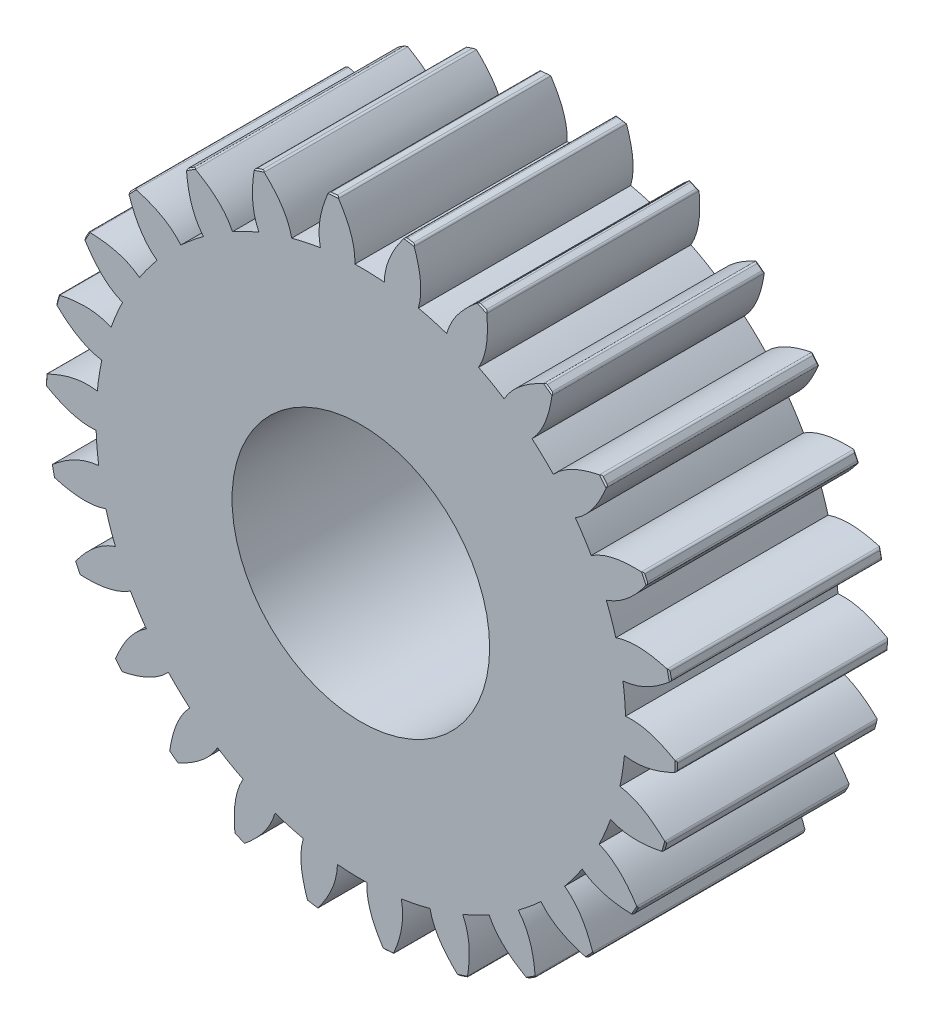
from build123d import *

# Parameters (mm, degrees)
BOSS_EXTRUDE1_DEPTH = 32.97
CHAMFER1_SIZE       = 0.2
FILLET1_R           = 0.4
CIRPATTERN1_DEPTH   = 32.97
SKETCH2_R           = 20
CUT_EXTRUDE1_DEPTH  = 77.636694373


with BuildPart() as part:
    # Sketch1 → Boss-Extrude1 (new body)
    with BuildSketch(Plane.XY):
        with BuildLine():
            add(Edge.make_bspline(
                [(-0.925368628, 41.114587653), (-0.902720236, 41.709621639), (-0.93904966, 42.292282206), (-1.024441582, 42.862759412)],
                knots=[-0.076387463, -0.076387463, -0.076387463, -0.076387463, 0, 0, 0, 0], degree=3))
            ThreePointArc((-1.024441582, 42.862759412), (-3.763344449, 42.709517248), (-6.486841795, 42.381440614))
            add(Edge.make_bspline(
                [(-6.278681799, 40.642881048), (-6.40503601, 41.224785686), (-6.471157416, 41.804821133), (-6.486841795, 42.381440614)],
                knots=[-0.076387463, -0.076387463, -0.076387463, -0.076387463, 0, 0, 0, 0], degree=3))
            ThreePointArc((-6.278681799, 40.642881048), (-3.609738553, 40.966271646), (-0.925368628, 41.114587653))
        make_face()
        with BuildLine():
            ThreePointArc((-6.486841795, 42.381440614), (-3.763344449, 42.709517248), (-1.024441582, 42.862759412))
            add(Edge.make_bspline(
                [(-1.024441582, 42.862759412), (-1.094438327, 43.330386175), (-1.505724376, 45.165619613), (-2.495832818, 47.152783337), (-3.42184293, 48.609180491), (-3.593178775, 48.868078193)],
                knots=[0, 0, 0, 0, 0.062615686, 0.250118172, 0.291291531, 0.291291531, 0.291291531, 0.291291531], degree=3))
            ThreePointArc((-3.593178775, 48.868078193), (-4.300965145, 48.81087685), (-5.007848271, 48.743424743))
            add(Edge.make_bspline(
                [(-6.486841795, 42.381440614), (-6.499698463, 42.85410227), (-6.415680867, 44.732979352), (-5.788328092, 46.862665284), (-5.131270019, 48.458554506), (-5.007848271, 48.743424743)],
                knots=[0, 0, 0, 0, 0.062615686, 0.250118172, 0.291291526, 0.291291526, 0.291291526, 0.291291526], degree=3))
        make_face()
        with BuildLine():
            ThreePointArc((41.125, 0), (28.750737731, 29.405113584), (-0.925368628, 41.114587653))
            ThreePointArc((-0.925368628, 41.114587653), (-3.609738553, 40.966271646), (-6.278681799, 40.642881048))
            ThreePointArc((-6.278681799, 40.642881048), (-26.768029774, -31.220797668), (41.125, 0))
        make_face()
    extrude(amount=BOSS_EXTRUDE1_DEPTH)

    # Chamfer1
    chamfer1_edges = [part.edges().sort_by_distance(p)[0] for p in [
        (-4.300965145, 48.81087685, 32.97),
        (-4.300965145, 48.81087685, 0),
    ]]
    chamfer(chamfer1_edges, length=CHAMFER1_SIZE)

    # Fillet1
    # the kernel refuses this fillet: 0.4 mm, written as the material it takes off along each edge
    with BuildSketch(Plane(origin=(-5.007848271, 48.743424743, -0.39511391), x_dir=(-0.3932429274357133, -0.9194346088884137, 0), z_dir=(0, 0, 1))) as fillet1_piece_1:
        with BuildLine():
            CenterArc((0.236166139, 0.399995585), FILLET1_R, 208.745087024, 61.524121721)
            ThreePointArc((-0.114541059, 0.207630149), (-0.057396129, 0.103745786), (0, 0))
            ThreePointArc((0, 0), (0.119022781, -0.000279267), (0.238045564, 0))
        make_face()
    extrude(amount=33.760227819, mode=Mode.SUBTRACT)
    with BuildSketch(Plane(origin=(-3.593178775, 48.868078193, -0.395113824), x_dir=(0.5479670220639341, -0.8364999358818769, 0), z_dir=(0, 0, 1))) as fillet1_piece_2:
        with BuildLine():
            CenterArc((0.236166105, -0.399995585), FILLET1_R, 89.73079124, 61.52411446)
            ThreePointArc((-0.114541069, -0.207630104), (-0.057396134, -0.103745764), (0, 0))
            ThreePointArc((0, 0), (0.119022764, 0.000279267), (0.23804553, 0))
        make_face()
    extrude(amount=33.760227649, mode=Mode.SUBTRACT)

    # CirPattern1: read off the stored shape, not the designer's step
    # CirPattern1 outline → CirPattern1 (add)
    with BuildSketch(Plane.XY):
        with BuildLine():
            add(Edge.make_bspline(
                [(-15.822712794, 37.959285884), (-16.084654275, 38.494042889), (-16.454076844, 39.490074357), (-16.93455551, 41.897747342), (-16.838691947, 44.035573473), (-16.602239944, 45.66531667), (-16.565905599, 45.893663153)],
                knots=[-0.076387463, -0.076387463, -0.076387463, -0.076387463, 0, 0.062615686, 0.250118172, 0.280770276, 0.280770276, 0.280770276, 0.280770276], degree=3))
            ThreePointArc((-15.822712794, 37.959285884), (-13.308716624, 38.911999266), (-10.737843954, 39.698417252))
            add(Edge.make_bspline(
                [(-10.737843954, 39.698417252), (-10.858254636, 40.281580746), (-11.176182918, 41.295224339), (-12.270811023, 43.492845362), (-13.655808387, 45.124186342), (-14.840795417, 46.26776753), (-15.009359658, 46.42603443)],
                knots=[-0.076387463, -0.076387463, -0.076387463, -0.076387463, 0, 0.062615686, 0.250118172, 0.280770282, 0.280770282, 0.280770282, 0.280770282], degree=3))
            ThreePointArc((-15.009359658, 46.42603443), (-15.197033625, 46.525043861), (-15.408942381, 46.514132204))
            ThreePointArc((-15.408942381, 46.514132204), (-15.857194317, 46.363233153), (-16.303968843, 46.208014456))
            ThreePointArc((-16.303968843, 46.208014456), (-16.478174627, 46.086866859), (-16.565905599, 45.893663153))
        make_face()
        with BuildLine():
            ThreePointArc((3.630243359, 40.964459695), (6.299024401, 40.639733224), (8.940885759, 40.141327666))
            add(Edge.make_bspline(
                [(8.940885759, 40.141327666), (9.105276983, 40.713650931), (9.294829136, 41.758936398), (9.346869498, 44.213532221), (8.878637192, 46.30165329), (8.360831962, 47.864935075), (8.285126035, 48.083409164)],
                knots=[-0.076387463, -0.076387463, -0.076387463, -0.076387463, 0, 0.062615686, 0.250118172, 0.280770282, 0.280770282, 0.280770282, 0.280770282], degree=3))
            ThreePointArc((8.285126035, 48.083409164), (8.164960967, 48.258294102), (7.972254183, 48.347111219))
            ThreePointArc((7.972254183, 48.347111219), (7.50522052, 48.421809807), (7.037487598, 48.491996951))
            ThreePointArc((7.037487598, 48.491996951), (6.826935941, 48.465683546), (6.659467784, 48.335380776))
            add(Edge.make_bspline(
                [(3.630243359, 40.964459695), (3.646819668, 41.559693784), (3.782591131, 42.613315076), (4.476049829, 44.968493199), (5.554430139, 46.81689421), (6.521177418, 48.150075418), (6.659467784, 48.335380776)],
                knots=[-0.076387463, -0.076387463, -0.076387463, -0.076387463, 0, 0.062615686, 0.250118172, 0.280770276, 0.280770276, 0.280770276, 0.280770276], degree=3))
        make_face()
        with BuildLine():
            ThreePointArc((13.328191969, 38.905332844), (15.841710953, 37.951361226), (18.287528363, 36.835199622))
            add(Edge.make_bspline(
                [(18.287528363, 36.835199622), (18.584108601, 37.35155082), (19.018305898, 38.321099391), (19.656257292, 40.691915047), (19.701351046, 42.831414437), (19.572710114, 44.473188998), (19.551488336, 44.703432241)],
                knots=[-0.076387463, -0.076387463, -0.076387463, -0.076387463, 0, 0.062615686, 0.250118172, 0.280770282, 0.280770282, 0.280770282, 0.280770282], degree=3))
            ThreePointArc((19.551488336, 44.703432241), (19.476667751, 44.901992723), (19.310816003, 45.034346729))
            ThreePointArc((19.310816003, 45.034346729), (18.875230031, 45.218643182), (18.437885461, 45.398726631))
            ThreePointArc((18.437885461, 45.398726631), (18.227154843, 45.423566156), (18.033369513, 45.3371275))
            add(Edge.make_bspline(
                [(13.328191969, 38.905332844), (13.486735441, 39.479303543), (13.870709712, 40.469816278), (15.107648777, 42.590601675), (16.597044631, 44.127218212), (17.854751138, 45.19030183), (18.033369513, 45.3371275)],
                knots=[-0.076387463, -0.076387463, -0.076387463, -0.076387463, 0, 0.062615686, 0.250118172, 0.280770276, 0.280770276, 0.280770276, 0.280770276], degree=3))
        make_face()
        with BuildLine():
            ThreePointArc((22.251554507, 34.585169464), (24.463734846, 33.057394062), (26.571366291, 31.388343667))
            add(Edge.make_bspline(
                [(26.571366291, 31.388343667), (26.982899376, 31.818714341), (27.63650785, 32.656179379), (28.823294859, 34.805431679), (29.379093989, 36.871969464), (29.647093498, 38.49682283), (29.681589201, 38.725454326)],
                knots=[-0.076387463, -0.076387463, -0.076387463, -0.076387463, 0, 0.062615686, 0.250118172, 0.280770282, 0.280770282, 0.280770282, 0.280770282], degree=3))
            ThreePointArc((29.681589201, 38.725454326), (29.6564614, 38.93615074), (29.527103389, 39.1043497))
            ThreePointArc((29.527103389, 39.1043497), (29.148279782, 39.38753338), (28.766740441, 39.667047337))
            ThreePointArc((28.766740441, 39.667047337), (28.568077759, 39.741596208), (28.359237354, 39.704045167))
            add(Edge.make_bspline(
                [(22.251554507, 34.585169464), (22.542851174, 35.104519681), (23.152713063, 35.974358859), (24.861246093, 37.737499193), (26.675099218, 38.873028687), (28.150671621, 39.60423216), (28.359237354, 39.704045167)],
                knots=[-0.076387463, -0.076387463, -0.076387463, -0.076387463, 0, 0.062615686, 0.250118172, 0.280770276, 0.280770276, 0.280770276, 0.280770276], degree=3))
        make_face()
        with BuildLine():
            ThreePointArc((29.881737577, 28.255041747), (31.664015391, 26.242251314), (33.310972994, 24.117311271))
            add(Edge.make_bspline(
                [(33.310972994, 24.117311271), (33.813542119, 24.436689842), (34.648576421, 25.093400922), (36.315227298, 26.896183134), (37.349430777, 28.769659649), (37.998495571, 30.283161249), (38.08670399, 30.496893768)],
                knots=[-0.076387463, -0.076387463, -0.076387463, -0.076387463, 0, 0.062615686, 0.250118172, 0.280770282, 0.280770282, 0.280770282, 0.280770282], degree=3))
            ThreePointArc((38.08670399, 30.496893768), (38.112729309, 30.707481203), (38.027382853, 30.901750005))
            ThreePointArc((38.027382853, 30.901750005), (37.727337462, 31.267363304), (37.423777029, 31.630063435))
            ThreePointArc((37.423777029, 31.630063435), (37.248727836, 31.749989143), (37.036969401, 31.763508048))
            add(Edge.make_bspline(
                [(29.881737577, 28.255041747), (30.288858336, 28.689588736), (31.089164888, 29.388202464), (33.169998153, 30.691230428), (35.202893998, 31.359680033), (36.810577394, 31.716508472), (37.036969401, 31.763508048)],
                knots=[-0.076387463, -0.076387463, -0.076387463, -0.076387463, 0, 0.062615686, 0.250118172, 0.280770276, 0.280770276, 0.280770276, 0.280770276], degree=3))
        make_face()
        with BuildLine():
            ThreePointArc((35.775302676, 20.282833706), (37.024098456, 17.902004307), (38.114667026, 15.444668407))
            add(Edge.make_bspline(
                [(38.114667026, 15.444668407), (38.679064702, 15.634493753), (39.646995672, 16.072285213), (41.696650726, 17.42382619), (43.149154409, 18.995361789), (44.1415632, 20.309552411), (44.278357982, 20.495964595)],
                knots=[-0.076387463, -0.076387463, -0.076387463, -0.076387463, 0, 0.062615686, 0.250118172, 0.280770282, 0.280770282, 0.280770282, 0.280770282], degree=3))
            ThreePointArc((44.278357982, 20.495964595), (44.354023925, 20.694204475), (44.317649049, 20.903252923))
            ThreePointArc((44.317649049, 20.903252923), (44.113819422, 21.330047726), (43.905879726, 21.754855217))
            ThreePointArc((43.905879726, 21.754855217), (43.764617245, 21.913188116), (43.562247411, 21.976991297))
            add(Edge.make_bspline(
                [(35.775302676, 20.282833706), (36.274587147, 20.607323175), (37.218827453, 21.094110564), (39.551030488, 21.861298908), (41.684824536, 22.023820764), (43.331186209, 21.985536596), (43.562247411, 21.976991297)],
                knots=[-0.076387463, -0.076387463, -0.076387463, -0.076387463, 0, 0.062615686, 0.250118172, 0.280770276, 0.280770276, 0.280770276, 0.280770276], degree=3))
        make_face()
        with BuildLine():
            ThreePointArc((39.589737221, 11.131861096), (40.232475496, 8.52135788), (40.703275152, 5.874437554))
            add(Edge.make_bspline(
                [(40.703275152, 5.874437554), (41.296700636, 5.923677716), (42.341275646, 6.117106709), (44.654816376, 6.9388598), (46.441206027, 8.117122548), (47.719283624, 9.155626209), (47.896714754, 9.30388446)],
                knots=[-0.076387463, -0.076387463, -0.076387463, -0.076387463, 0, 0.062615686, 0.250118172, 0.280770282, 0.280770282, 0.280770282, 0.280770282], degree=3))
            ThreePointArc((47.896714754, 9.30388446), (48.017623891, 9.478255804), (48.032334571, 9.689934761))
            ThreePointArc((48.032334571, 9.689934761), (47.936566544, 10.153107306), (47.836332284, 10.61533389))
            ThreePointArc((47.836332284, 10.61533389), (47.737066177, 10.802872247), (47.555845943, 10.913251694))
            add(Edge.make_bspline(
                [(39.589737221, 11.131861096), (40.152168805, 11.327434896), (41.185467052, 11.574105632), (43.633500694, 11.760868159), (45.74418459, 11.408017084), (47.333543984, 10.976845248), (47.555845943, 10.913251694)],
                knots=[-0.076387463, -0.076387463, -0.076387463, -0.076387463, 0, 0.062615686, 0.250118172, 0.280770276, 0.280770276, 0.280770276, 0.280770276], degree=3))
        make_face()
        with BuildLine():
            ThreePointArc((41.103360142, 1.333945182), (41.1026873, -1.354518892), (40.926356877, -4.037194257))
            add(Edge.make_bspline(
                [(40.926356877, -4.037194257), (41.514322437, -4.131400938), (42.574834583, -4.193575802), (45.017806411, -3.949367899), (47.034263558, -3.232854352), (48.523732736, -2.530391709), (48.731488562, -2.428903622)],
                knots=[-0.076387463, -0.076387463, -0.076387463, -0.076387463, 0, 0.062615686, 0.250118172, 0.280770282, 0.280770282, 0.280770282, 0.280770282], degree=3))
            ThreePointArc((48.731488562, -2.428903622), (48.890614093, -2.288534643), (48.955555398, -2.086527188))
            ThreePointArc((48.955555398, -2.086527188), (48.973414661, -1.613894806), (48.986711089, -1.141112058))
            ThreePointArc((48.986711089, -1.141112058), (48.93521034, -0.935267291), (48.785671568, -0.784726429))
            add(Edge.make_bspline(
                [(41.103360142, 1.333945182), (41.69625236, 1.389237275), (42.758557009, 1.381455751), (45.18015044, 0.976938501), (47.145058909, 0.129220919), (48.585048233, -0.669780447), (48.785671568, -0.784726429)],
                knots=[-0.076387463, -0.076387463, -0.076387463, -0.076387463, 0, 0.062615686, 0.250118172, 0.280770276, 0.280770276, 0.280770276, 0.280770276], degree=3))
        make_face()
        with BuildLine():
            ThreePointArc((40.228205176, -8.541494777), (39.58416032, -11.15167595), (38.770947502, -13.714199012))
            add(Edge.make_bspline(
                [(38.770947502, -13.714199012), (39.319282716, -13.946377587), (40.334098888, -14.260542931), (42.764525171, -14.608072692), (44.893860654, -14.394949508), (46.508158879, -14.069352458), (46.734165386, -14.020532654)],
                knots=[-0.076387463, -0.076387463, -0.076387463, -0.076387463, 0, 0.062615686, 0.250118172, 0.280770282, 0.280770282, 0.280770282, 0.280770282], degree=3))
            ThreePointArc((46.734165386, -14.020532654), (46.922259514, -13.922323775), (47.033657291, -13.74172776))
            ThreePointArc((47.033657291, -13.74172776), (47.164105929, -13.287103218), (47.290160304, -12.831240721))
            ThreePointArc((47.290160304, -12.831240721), (47.289417951, -12.619052492), (47.18025129, -12.437099104))
            add(Edge.make_bspline(
                [(40.228205176, -8.541494777), (40.817101288, -8.629697767), (41.846675053, -8.891479317), (44.101094066, -9.863767272), (45.80603377, -11.157085097), (47.012966079, -12.277480937), (47.18025129, -12.437099104)],
                knots=[-0.076387463, -0.076387463, -0.076387463, -0.076387463, 0, 0.062615686, 0.250118172, 0.280770276, 0.280770276, 0.280770276, 0.280770276], degree=3))
        make_face()
        with BuildLine():
            ThreePointArc((37.015133149, -17.920534107), (35.765145825, -20.300738137), (34.362311584, -22.59418437))
            add(Edge.make_bspline(
                [(34.362311584, -22.59418437), (34.839149204, -22.950841463), (35.749291974, -23.49873914), (38.025925171, -24.417809398), (40.14438975, -24.720462522), (41.789699877, -24.790653583), (42.02082239, -24.797339291)],
                knots=[-0.076387463, -0.076387463, -0.076387463, -0.076387463, 0, 0.062615686, 0.250118172, 0.280770282, 0.280770282, 0.280770282, 0.280770282], degree=3))
            ThreePointArc((42.02082239, -24.797339291), (42.226953768, -24.746998054), (42.378333983, -24.598309065))
            ThreePointArc((42.378333983, -24.598309065), (42.613790795, -24.188113488), (42.845277295, -23.775664313))
            ThreePointArc((42.845277295, -23.775664313), (42.895336481, -23.569464232), (42.8328863, -23.366672786))
            add(Edge.make_bspline(
                [(37.015133149, -17.920534107), (37.565808653, -18.147106143), (38.50281645, -18.647673926), (40.459042406, -20.131226744), (41.804928446, -21.794981881), (42.708661221, -23.171658862), (42.8328863, -23.366672786)],
                knots=[-0.076387463, -0.076387463, -0.076387463, -0.076387463, 0, 0.062615686, 0.250118172, 0.280770276, 0.280770276, 0.280770276, 0.280770276], degree=3))
        make_face()
        with BuildLine():
            ThreePointArc((31.650876128, -26.258097134), (29.867591055, -28.269995213), (27.956663019, -30.161077859))
            add(Edge.make_bspline(
                [(27.956663019, -30.161077859), (28.334290975, -30.621485857), (29.086866153, -31.371274044), (31.077396618, -32.808471777), (33.061872834, -33.609312109), (34.642575418, -34.071212031), (34.865381936, -34.133014703)],
                knots=[-0.076387463, -0.076387463, -0.076387463, -0.076387463, 0, 0.062615686, 0.250118172, 0.280770282, 0.280770282, 0.280770282, 0.280770282], degree=3))
            ThreePointArc((34.865381936, -34.133014703), (35.077570957, -34.133466758), (35.260135943, -34.025326057))
            ThreePointArc((35.260135943, -34.025326057), (35.586917035, -33.683398522), (35.910382506, -33.338332716))
            ThreePointArc((35.910382506, -33.338332716), (36.008333972, -33.150104382), (35.99622965, -32.938260381))
            add(Edge.make_bspline(
                [(31.650876128, -26.258097134), (32.131327765, -26.609870672), (32.921314107, -27.320133508), (34.465658264, -29.228732492), (35.374272636, -31.16623354), (35.922284213, -32.719184199), (35.99622965, -32.938260381)],
                knots=[-0.076387463, -0.076387463, -0.076387463, -0.076387463, 0, 0.062615686, 0.250118172, 0.280770276, 0.280770276, 0.280770276, 0.280770276], degree=3))
        make_face()
        with BuildLine():
            ThreePointArc((24.447185233, -33.069635), (22.234240458, -34.596302926), (19.926274818, -35.975119134))
            add(Edge.make_bspline(
                [(19.926274818, -35.975119134), (20.182746745, -36.512520797), (20.734017399, -37.420624531), (22.322762736, -39.29242503), (24.057920043, -40.544910641), (25.482150396, -41.37167548), (25.683692215, -41.485003368)],
                knots=[-0.076387463, -0.076387463, -0.076387463, -0.076387463, 0, 0.062615686, 0.250118172, 0.280770282, 0.280770282, 0.280770282, 0.280770282], degree=3))
            ThreePointArc((25.683692215, -41.485003368), (25.889607225, -41.536222445), (26.092746967, -41.474914777))
            ThreePointArc((26.092746967, -41.474914777), (26.49186101, -41.221126868), (26.888506815, -40.963498401))
            ThreePointArc((26.888506815, -40.963498401), (27.028657978, -40.804180961), (27.067602973, -40.595596008))
            add(Edge.make_bspline(
                [(24.447185233, -33.069635), (24.8294909, -33.52616624), (25.426544652, -34.404846236), (26.469255341, -36.627570549), (26.88779268, -38.72621699), (27.048234618, -40.36518948), (27.067602973, -40.595596008)],
                knots=[-0.076387463, -0.076387463, -0.076387463, -0.076387463, 0, 0.062615686, 0.250118172, 0.280770276, 0.280770276, 0.280770276, 0.280770276], degree=3))
        make_face()
        with BuildLine():
            ThreePointArc((15.822712793, -37.959285883), (13.308716623, -38.911999265), (10.737843953, -39.69841725))
            add(Edge.make_bspline(
                [(10.737843953, -39.69841725), (10.858254636, -40.281580746), (11.176182918, -41.295224339), (12.270811023, -43.492845362), (13.655808387, -45.124186342), (14.840795417, -46.26776753), (15.009359658, -46.42603443)],
                knots=[-0.076387463, -0.076387463, -0.076387463, -0.076387463, 0, 0.062615686, 0.250118172, 0.280770282, 0.280770282, 0.280770282, 0.280770282], degree=3))
            ThreePointArc((15.009359658, -46.42603443), (15.197033625, -46.525043861), (15.408942381, -46.514132204))
            ThreePointArc((15.408942381, -46.514132204), (15.857194317, -46.363233153), (16.303968843, -46.208014456))
            ThreePointArc((16.303968843, -46.208014456), (16.478174627, -46.086866859), (16.565905599, -45.893663153))
            add(Edge.make_bspline(
                [(15.822712793, -37.959285883), (16.084654275, -38.494042889), (16.454076844, -39.490074357), (16.93455551, -41.897747342), (16.838691947, -44.035573473), (16.602239944, -45.66531667), (16.565905599, -45.893663153)],
                knots=[-0.076387463, -0.076387463, -0.076387463, -0.076387463, 0, 0.062615686, 0.250118172, 0.280770276, 0.280770276, 0.280770276, 0.280770276], degree=3))
        make_face()
        with BuildLine():
            ThreePointArc((6.278681799, -40.642881047), (3.609738553, -40.966271646), (0.925368628, -41.114587654))
            add(Edge.make_bspline(
                [(0.925368628, -41.114587654), (0.902720236, -41.709621639), (0.96882931, -42.76989581), (1.505724376, -45.165619613), (2.460070783, -47.081008352), (3.336947353, -48.474945108), (3.462737675, -48.668953123)],
                knots=[-0.076387463, -0.076387463, -0.076387463, -0.076387463, 0, 0.062615686, 0.250118172, 0.280770282, 0.280770282, 0.280770282, 0.280770282], degree=3))
            ThreePointArc((3.462737675, -48.668953123), (3.62126367, -48.809998839), (3.829626072, -48.85011734))
            ThreePointArc((3.829626072, -48.85011734), (4.300965128, -48.810876851), (4.771903465, -48.76708867))
            ThreePointArc((4.771903465, -48.76708867), (4.970039663, -48.691151575), (5.101458005, -48.524557413))
            add(Edge.make_bspline(
                [(6.278681799, -40.642881047), (6.40503601, -41.224785686), (6.525357898, -42.280282896), (6.415680867, -44.732979352), (5.810987644, -46.785742488), (5.191383431, -48.311541641), (5.101458005, -48.524557413)],
                knots=[-0.076387463, -0.076387463, -0.076387463, -0.076387463, 0, 0.062615686, 0.250118172, 0.280770276, 0.280770276, 0.280770276, 0.280770276], degree=3))
        make_face()
        with BuildLine():
            ThreePointArc((-3.630243359, -40.964459696), (-6.299024402, -40.639733226), (-8.940885759, -40.141327668))
            add(Edge.make_bspline(
                [(-8.940885759, -40.141327668), (-9.105276983, -40.713650931), (-9.294829136, -41.758936398), (-9.346869498, -44.213532221), (-8.878637192, -46.30165329), (-8.360831962, -47.864935075), (-8.285126035, -48.083409164)],
                knots=[-0.076387463, -0.076387463, -0.076387463, -0.076387463, 0, 0.062615686, 0.250118172, 0.280770282, 0.280770282, 0.280770282, 0.280770282], degree=3))
            ThreePointArc((-8.285126035, -48.083409164), (-8.164960967, -48.258294102), (-7.972254183, -48.347111219))
            ThreePointArc((-7.972254183, -48.347111219), (-7.50522052, -48.421809807), (-7.037487598, -48.491996951))
            ThreePointArc((-7.037487598, -48.491996951), (-6.826935941, -48.465683546), (-6.659467784, -48.335380776))
            add(Edge.make_bspline(
                [(-3.630243359, -40.964459696), (-3.646819668, -41.559693784), (-3.782591131, -42.613315076), (-4.476049829, -44.968493199), (-5.554430139, -46.81689421), (-6.521177418, -48.150075418), (-6.659467784, -48.335380776)],
                knots=[-0.076387463, -0.076387463, -0.076387463, -0.076387463, 0, 0.062615686, 0.250118172, 0.280770276, 0.280770276, 0.280770276, 0.280770276], degree=3))
        make_face()
        with BuildLine():
            ThreePointArc((-13.32819197, -38.905332847), (-15.841710954, -37.95136123), (-18.287528365, -36.835199626))
            add(Edge.make_bspline(
                [(-18.287528365, -36.835199626), (-18.584108601, -37.35155082), (-19.018305898, -38.321099391), (-19.656257292, -40.691915047), (-19.701351046, -42.831414437), (-19.572710114, -44.473188998), (-19.551488336, -44.703432241)],
                knots=[-0.076387463, -0.076387463, -0.076387463, -0.076387463, 0, 0.062615686, 0.250118172, 0.280770282, 0.280770282, 0.280770282, 0.280770282], degree=3))
            ThreePointArc((-19.551488336, -44.703432241), (-19.476667751, -44.901992723), (-19.310816003, -45.034346729))
            ThreePointArc((-19.310816003, -45.034346729), (-18.875230031, -45.218643182), (-18.437885461, -45.398726631))
            ThreePointArc((-18.437885461, -45.398726631), (-18.227154843, -45.423566156), (-18.033369513, -45.3371275))
            add(Edge.make_bspline(
                [(-13.32819197, -38.905332847), (-13.486735441, -39.479303543), (-13.870709712, -40.469816278), (-15.107648777, -42.590601675), (-16.597044631, -44.127218212), (-17.854751138, -45.19030183), (-18.033369513, -45.3371275)],
                knots=[-0.076387463, -0.076387463, -0.076387463, -0.076387463, 0, 0.062615686, 0.250118172, 0.280770276, 0.280770276, 0.280770276, 0.280770276], degree=3))
        make_face()
        with BuildLine():
            ThreePointArc((-22.251554509, -34.585169468), (-24.463734849, -33.057394066), (-26.571366295, -31.388343671))
            add(Edge.make_bspline(
                [(-26.571366295, -31.388343671), (-26.982899376, -31.818714341), (-27.63650785, -32.656179379), (-28.823294859, -34.805431679), (-29.379093989, -36.871969464), (-29.647093498, -38.49682283), (-29.681589201, -38.725454326)],
                knots=[-0.076387463, -0.076387463, -0.076387463, -0.076387463, 0, 0.062615686, 0.250118172, 0.280770282, 0.280770282, 0.280770282, 0.280770282], degree=3))
            ThreePointArc((-29.681589201, -38.725454326), (-29.6564614, -38.93615074), (-29.527103389, -39.1043497))
            ThreePointArc((-29.527103389, -39.1043497), (-29.148279782, -39.38753338), (-28.766740441, -39.667047337))
            ThreePointArc((-28.766740441, -39.667047337), (-28.568077759, -39.741596208), (-28.359237354, -39.704045167))
            add(Edge.make_bspline(
                [(-22.251554509, -34.585169468), (-22.542851174, -35.104519681), (-23.152713063, -35.974358859), (-24.861246093, -37.737499193), (-26.675099218, -38.873028687), (-28.150671621, -39.60423216), (-28.359237354, -39.704045167)],
                knots=[-0.076387463, -0.076387463, -0.076387463, -0.076387463, 0, 0.062615686, 0.250118172, 0.280770276, 0.280770276, 0.280770276, 0.280770276], degree=3))
        make_face()
        with BuildLine():
            ThreePointArc((-29.881737582, -28.255041751), (-31.664015396, -26.242251318), (-33.310972999, -24.117311275))
            add(Edge.make_bspline(
                [(-33.310972999, -24.117311275), (-33.813542119, -24.436689842), (-34.648576421, -25.093400922), (-36.315227298, -26.896183134), (-37.349430777, -28.769659649), (-37.998495571, -30.283161249), (-38.08670399, -30.496893768)],
                knots=[-0.076387463, -0.076387463, -0.076387463, -0.076387463, 0, 0.062615686, 0.250118172, 0.280770282, 0.280770282, 0.280770282, 0.280770282], degree=3))
            ThreePointArc((-38.08670399, -30.496893768), (-38.112729309, -30.707481203), (-38.027382853, -30.901750005))
            ThreePointArc((-38.027382853, -30.901750005), (-37.727337462, -31.267363304), (-37.423777029, -31.630063435))
            ThreePointArc((-37.423777029, -31.630063435), (-37.248727836, -31.749989143), (-37.036969401, -31.763508048))
            add(Edge.make_bspline(
                [(-29.881737582, -28.255041751), (-30.288858336, -28.689588736), (-31.089164888, -29.388202464), (-33.169998153, -30.691230428), (-35.202893998, -31.359680033), (-36.810577394, -31.716508472), (-37.036969401, -31.763508048)],
                knots=[-0.076387463, -0.076387463, -0.076387463, -0.076387463, 0, 0.062615686, 0.250118172, 0.280770276, 0.280770276, 0.280770276, 0.280770276], degree=3))
        make_face()
        with BuildLine():
            ThreePointArc((-35.775302682, -20.28283371), (-37.024098463, -17.90200431), (-38.114667033, -15.444668409))
            add(Edge.make_bspline(
                [(-38.114667033, -15.444668409), (-38.679064702, -15.634493753), (-39.646995672, -16.072285213), (-41.696650726, -17.42382619), (-43.149154409, -18.995361789), (-44.1415632, -20.309552411), (-44.278357982, -20.495964595)],
                knots=[-0.076387463, -0.076387463, -0.076387463, -0.076387463, 0, 0.062615686, 0.250118172, 0.280770282, 0.280770282, 0.280770282, 0.280770282], degree=3))
            ThreePointArc((-44.278357982, -20.495964595), (-44.354023925, -20.694204475), (-44.317649049, -20.903252923))
            ThreePointArc((-44.317649049, -20.903252923), (-44.113819422, -21.330047726), (-43.905879726, -21.754855217))
            ThreePointArc((-43.905879726, -21.754855217), (-43.764617245, -21.913188116), (-43.562247411, -21.976991297))
            add(Edge.make_bspline(
                [(-35.775302682, -20.28283371), (-36.274587147, -20.607323175), (-37.218827453, -21.094110564), (-39.551030488, -21.861298908), (-41.684824536, -22.023820764), (-43.331186209, -21.985536596), (-43.562247411, -21.976991297)],
                knots=[-0.076387463, -0.076387463, -0.076387463, -0.076387463, 0, 0.062615686, 0.250118172, 0.280770276, 0.280770276, 0.280770276, 0.280770276], degree=3))
        make_face()
        with BuildLine():
            ThreePointArc((-39.589737228, -11.131861098), (-40.232475504, -8.521357882), (-40.70327516, -5.874437555))
            add(Edge.make_bspline(
                [(-40.70327516, -5.874437555), (-41.296700636, -5.923677716), (-42.341275646, -6.117106709), (-44.654816376, -6.9388598), (-46.441206027, -8.117122548), (-47.719283624, -9.155626209), (-47.896714754, -9.30388446)],
                knots=[-0.076387463, -0.076387463, -0.076387463, -0.076387463, 0, 0.062615686, 0.250118172, 0.280770282, 0.280770282, 0.280770282, 0.280770282], degree=3))
            ThreePointArc((-47.896714754, -9.30388446), (-48.017623891, -9.478255804), (-48.032334571, -9.689934761))
            ThreePointArc((-48.032334571, -9.689934761), (-47.936566544, -10.153107306), (-47.836332284, -10.61533389))
            ThreePointArc((-47.836332284, -10.61533389), (-47.737066177, -10.802872247), (-47.555845943, -10.913251694))
            add(Edge.make_bspline(
                [(-39.589737228, -11.131861098), (-40.152168805, -11.327434896), (-41.185467052, -11.574105632), (-43.633500694, -11.760868159), (-45.74418459, -11.408017084), (-47.333543984, -10.976845248), (-47.555845943, -10.913251694)],
                knots=[-0.076387463, -0.076387463, -0.076387463, -0.076387463, 0, 0.062615686, 0.250118172, 0.280770276, 0.280770276, 0.280770276, 0.280770276], degree=3))
        make_face()
        with BuildLine():
            ThreePointArc((-41.103360149, -1.333945182), (-41.102687307, 1.354518892), (-40.926356884, 4.037194258))
            add(Edge.make_bspline(
                [(-40.926356884, 4.037194258), (-41.514322437, 4.131400938), (-42.574834583, 4.193575802), (-45.017806411, 3.949367899), (-47.034263558, 3.232854352), (-48.523732736, 2.530391709), (-48.731488562, 2.428903622)],
                knots=[-0.076387463, -0.076387463, -0.076387463, -0.076387463, 0, 0.062615686, 0.250118172, 0.280770282, 0.280770282, 0.280770282, 0.280770282], degree=3))
            ThreePointArc((-48.731488562, 2.428903622), (-48.890614093, 2.288534643), (-48.955555398, 2.086527188))
            ThreePointArc((-48.955555398, 2.086527188), (-48.973414661, 1.613894806), (-48.986711089, 1.141112058))
            ThreePointArc((-48.986711089, 1.141112058), (-48.93521034, 0.935267291), (-48.785671568, 0.784726429))
            add(Edge.make_bspline(
                [(-41.103360149, -1.333945182), (-41.69625236, -1.389237275), (-42.758557009, -1.381455751), (-45.18015044, -0.976938501), (-47.145058909, -0.129220919), (-48.585048233, 0.669780447), (-48.785671568, 0.784726429)],
                knots=[-0.076387463, -0.076387463, -0.076387463, -0.076387463, 0, 0.062615686, 0.250118172, 0.280770276, 0.280770276, 0.280770276, 0.280770276], degree=3))
        make_face()
        with BuildLine():
            ThreePointArc((-40.228205183, 8.541494779), (-39.584160326, 11.151675952), (-38.770947508, 13.714199014))
            add(Edge.make_bspline(
                [(-38.770947508, 13.714199014), (-39.319282716, 13.946377587), (-40.334098888, 14.260542931), (-42.764525171, 14.608072692), (-44.893860654, 14.394949508), (-46.508158879, 14.069352458), (-46.734165386, 14.020532654)],
                knots=[-0.076387463, -0.076387463, -0.076387463, -0.076387463, 0, 0.062615686, 0.250118172, 0.280770282, 0.280770282, 0.280770282, 0.280770282], degree=3))
            ThreePointArc((-46.734165386, 14.020532654), (-46.922259514, 13.922323775), (-47.033657291, 13.74172776))
            ThreePointArc((-47.033657291, 13.74172776), (-47.164105929, 13.287103218), (-47.290160304, 12.831240721))
            ThreePointArc((-47.290160304, 12.831240721), (-47.289417951, 12.619052492), (-47.18025129, 12.437099104))
            add(Edge.make_bspline(
                [(-40.228205183, 8.541494779), (-40.817101288, 8.629697767), (-41.846675053, 8.891479317), (-44.101094066, 9.863767272), (-45.80603377, 11.157085097), (-47.012966079, 12.277480937), (-47.18025129, 12.437099104)],
                knots=[-0.076387463, -0.076387463, -0.076387463, -0.076387463, 0, 0.062615686, 0.250118172, 0.280770276, 0.280770276, 0.280770276, 0.280770276], degree=3))
        make_face()
        with BuildLine():
            ThreePointArc((-37.015133155, 17.92053411), (-35.76514583, 20.30073814), (-34.362311589, 22.594184373))
            add(Edge.make_bspline(
                [(-34.362311589, 22.594184373), (-34.839149204, 22.950841463), (-35.749291974, 23.49873914), (-38.025925171, 24.417809398), (-40.14438975, 24.720462522), (-41.789699877, 24.790653583), (-42.02082239, 24.797339291)],
                knots=[-0.076387463, -0.076387463, -0.076387463, -0.076387463, 0, 0.062615686, 0.250118172, 0.280770282, 0.280770282, 0.280770282, 0.280770282], degree=3))
            ThreePointArc((-42.02082239, 24.797339291), (-42.226953768, 24.746998054), (-42.378333983, 24.598309065))
            ThreePointArc((-42.378333983, 24.598309065), (-42.613790795, 24.188113488), (-42.845277295, 23.775664313))
            ThreePointArc((-42.845277295, 23.775664313), (-42.895336481, 23.569464232), (-42.8328863, 23.366672786))
            add(Edge.make_bspline(
                [(-37.015133155, 17.92053411), (-37.565808653, 18.147106143), (-38.50281645, 18.647673926), (-40.459042406, 20.131226744), (-41.804928446, 21.794981881), (-42.708661221, 23.171658862), (-42.8328863, 23.366672786)],
                knots=[-0.076387463, -0.076387463, -0.076387463, -0.076387463, 0, 0.062615686, 0.250118172, 0.280770276, 0.280770276, 0.280770276, 0.280770276], degree=3))
        make_face()
        with BuildLine():
            ThreePointArc((-31.650876132, 26.258097138), (-29.867591059, 28.269995217), (-27.956663023, 30.161077863))
            add(Edge.make_bspline(
                [(-27.956663023, 30.161077863), (-28.334290975, 30.621485857), (-29.086866153, 31.371274044), (-31.077396618, 32.808471777), (-33.061872834, 33.609312109), (-34.642575418, 34.071212031), (-34.865381936, 34.133014703)],
                knots=[-0.076387463, -0.076387463, -0.076387463, -0.076387463, 0, 0.062615686, 0.250118172, 0.280770282, 0.280770282, 0.280770282, 0.280770282], degree=3))
            ThreePointArc((-34.865381936, 34.133014703), (-35.077570957, 34.133466758), (-35.260135943, 34.025326057))
            ThreePointArc((-35.260135943, 34.025326057), (-35.586917035, 33.683398522), (-35.910382506, 33.338332716))
            ThreePointArc((-35.910382506, 33.338332716), (-36.008333972, 33.150104382), (-35.99622965, 32.938260381))
            add(Edge.make_bspline(
                [(-31.650876132, 26.258097138), (-32.131327765, 26.609870672), (-32.921314107, 27.320133508), (-34.465658264, 29.228732492), (-35.374272636, 31.16623354), (-35.922284213, 32.719184199), (-35.99622965, 32.938260381)],
                knots=[-0.076387463, -0.076387463, -0.076387463, -0.076387463, 0, 0.062615686, 0.250118172, 0.280770276, 0.280770276, 0.280770276, 0.280770276], degree=3))
        make_face()
        with BuildLine():
            add(Edge.make_bspline(
                [(-24.447185234, 33.069635002), (-24.8294909, 33.52616624), (-25.426544652, 34.404846236), (-26.469255341, 36.627570549), (-26.88779268, 38.72621699), (-27.048234618, 40.36518948), (-27.067602973, 40.595596008)],
                knots=[-0.076387463, -0.076387463, -0.076387463, -0.076387463, 0, 0.062615686, 0.250118172, 0.280770276, 0.280770276, 0.280770276, 0.280770276], degree=3))
            ThreePointArc((-24.447185234, 33.069635002), (-22.23424046, 34.596302929), (-19.92627482, 35.975119137))
            add(Edge.make_bspline(
                [(-19.92627482, 35.975119137), (-20.182746745, 36.512520797), (-20.734017399, 37.420624531), (-22.322762736, 39.29242503), (-24.057920043, 40.544910641), (-25.482150396, 41.37167548), (-25.683692215, 41.485003368)],
                knots=[-0.076387463, -0.076387463, -0.076387463, -0.076387463, 0, 0.062615686, 0.250118172, 0.280770282, 0.280770282, 0.280770282, 0.280770282], degree=3))
            ThreePointArc((-25.683692215, 41.485003368), (-25.889607225, 41.536222445), (-26.092746967, 41.474914777))
            ThreePointArc((-26.092746967, 41.474914777), (-26.49186101, 41.221126868), (-26.888506815, 40.963498401))
            ThreePointArc((-26.888506815, 40.963498401), (-27.028657978, 40.804180961), (-27.067602973, 40.595596008))
        make_face()
    extrude(amount=CIRPATTERN1_DEPTH)

    # CirPattern1 2 outline → CirPattern1 2 (revolve, cut)
    with BuildSketch(Plane.XZ):
        Polygon((49.000006037, 0.200006037), (48.8, 0), (49.000006037, 0), align=None)
        Polygon((48.8, 32.97), (49.000006037, 32.769993963), (49.000006037, 32.97), align=None)
    revolve(axis=Axis((0, 0, 0), (0, 0, 1)), mode=Mode.SUBTRACT)

    # Sketch2 → Cut-Extrude1 (cut, through all)
    with BuildSketch(Plane.XY.offset(32.97)):
        Circle(SKETCH2_R)
    extrude(amount=-CUT_EXTRUDE1_DEPTH, mode=Mode.SUBTRACT)


solid = part.part
